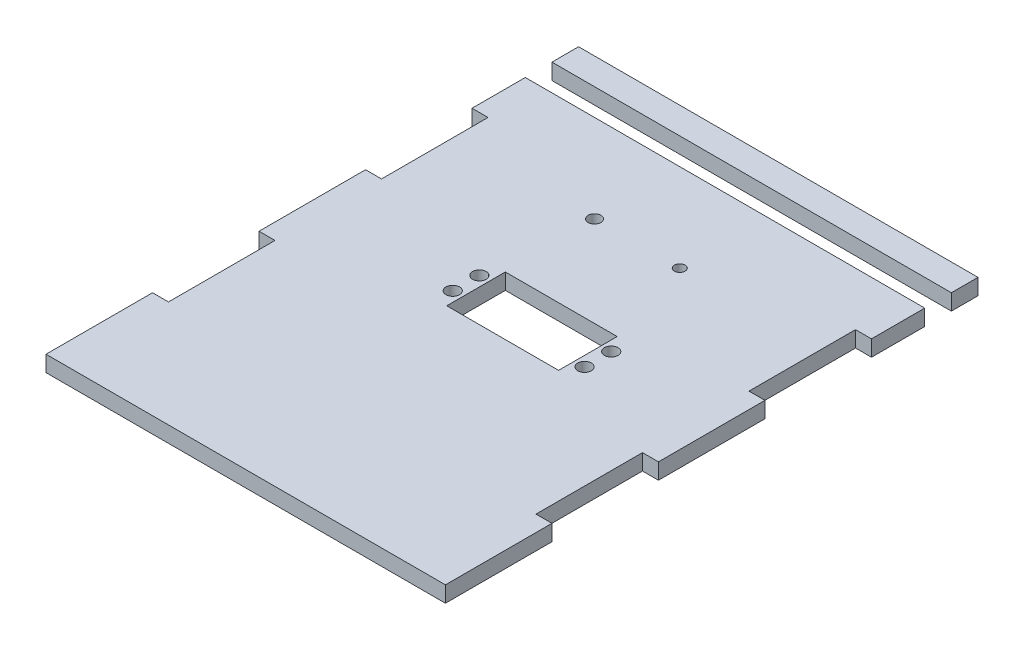
from build123d import *

# Parameters (mm, degrees)
SKETCH1_W           = 150
SKETCH1_H           = 200
BOSS_EXTRUDE1_DEPTH = 6
SKETCH2_W           = 6
SKETCH2_H           = 40
CUT_EXTRUDE1_DEPTH  = 6
SKETCH6_R           = 1.23
CUT_EXTRUDE6_DEPTH  = 126.143917151
SKETCH7_R           = 2
CUT_EXTRUDE7_DEPTH  = 126.143917151
SKETCH8_R           = 2.38
CUT_EXTRUDE8_DEPTH  = 126.143917151
SKETCH9_R           = 2.55
CUT_EXTRUDE9_DEPTH  = 126.143917151
SKETCH10_W          = 150
SKETCH10_H          = 10
CUT_EXTRUDE10_DEPTH = 6
SKETCH11_W          = 42
SKETCH11_H          = 22
CUT_EXTRUDE11_DEPTH = 6


with BuildPart() as part:
    # Sketch1 → Boss-Extrude1 (new body)
    with BuildSketch(Plane(origin=(0, 0, 0), x_dir=(1, 0, 0), z_dir=(0, 1, 0))):
        Rectangle(SKETCH1_W, SKETCH1_H)
    extrude(amount=BOSS_EXTRUDE1_DEPTH)

    # Sketch2 → Cut-Extrude1 (cut)
    with BuildSketch(Plane(origin=(0, 6, 0), x_dir=(1, 0, 0), z_dir=(0, 1, 0))):
        with Locations((-72, 40)):
            Rectangle(SKETCH2_W, SKETCH2_H)
        with Locations((72, 40)):
            Rectangle(SKETCH2_W, SKETCH2_H)
        with Locations((72, -40)):
            Rectangle(SKETCH2_W, SKETCH2_H)
        with Locations((-72, -40)):
            Rectangle(SKETCH2_W, SKETCH2_H)
    extrude(amount=-CUT_EXTRUDE1_DEPTH, mode=Mode.SUBTRACT)

    # Sketch6 → Cut-Extrude6 (cut, through all)
    with BuildSketch(Plane(origin=(0, 6, 0), x_dir=(1, 0, 0), z_dir=(0, 1, 0))):
        with Locations((16, 2)):
            Circle(SKETCH6_R)
    extrude(amount=-CUT_EXTRUDE6_DEPTH, mode=Mode.SUBTRACT)

    # Sketch7 → Cut-Extrude7 (cut, through all)
    with BuildSketch(Plane(origin=(0, 6, 0), x_dir=(1, 0, 0), z_dir=(0, 1, 0))):
        with Locations((16, 47)):
            Circle(SKETCH7_R)
    extrude(amount=-CUT_EXTRUDE7_DEPTH, mode=Mode.SUBTRACT)

    # Sketch8 → Cut-Extrude8 (cut, through all)
    with BuildSketch(Plane(origin=(0, 6, 0), x_dir=(1, 0, 0), z_dir=(0, 1, 0))):
        with Locations((-16, 47)):
            Circle(SKETCH8_R)
    extrude(amount=-CUT_EXTRUDE8_DEPTH, mode=Mode.SUBTRACT)

    # Sketch9 → Cut-Extrude9 (cut, through all)
    with BuildSketch(Plane(origin=(0, 6, 0), x_dir=(1, 0, 0), z_dir=(0, 1, 0))):
        with Locations((30.25, 7)):
            Circle(SKETCH9_R)
        with Locations((30.25, -3)):
            Circle(SKETCH9_R)
        with Locations((-19.25, 7)):
            Circle(SKETCH9_R)
        with Locations((-19.25, -3)):
            Circle(SKETCH9_R)
    extrude(amount=-CUT_EXTRUDE9_DEPTH, mode=Mode.SUBTRACT)

    # Sketch10 → Cut-Extrude10 (cut)
    with BuildSketch(Plane(origin=(0, 6, 0), x_dir=(1, 0, 0), z_dir=(0, 1, 0))):
        with Locations((0, 85)):
            Rectangle(SKETCH10_W, SKETCH10_H)
    extrude(amount=-CUT_EXTRUDE10_DEPTH, mode=Mode.SUBTRACT)


with BuildPart() as cut_extrude10_piece_1:
    # of the separate pieces the step leaves, piece 1, a body of its own (cut_extrude10_pieces)
    add(part.part.solids().sort_by_distance((-75, 0, -60))[0])

    # Sketch11 → Cut-Extrude11 (cut)
    with BuildSketch(Plane(origin=(0, 6, 0), x_dir=(1, 0, 0), z_dir=(0, 1, 0))):
        with Locations((5.5, 2)):
            Rectangle(SKETCH11_W, SKETCH11_H)
    extrude(amount=-CUT_EXTRUDE11_DEPTH, mode=Mode.SUBTRACT)


with BuildPart() as cut_extrude10_piece_2:
    # of the separate pieces the step leaves, piece 2, a body of its own (cut_extrude10_pieces)
    add(part.part.solids().sort_by_distance((-75, 0, -100))[0])


solid = Compound([cut_extrude10_piece_1.part, cut_extrude10_piece_2.part])
